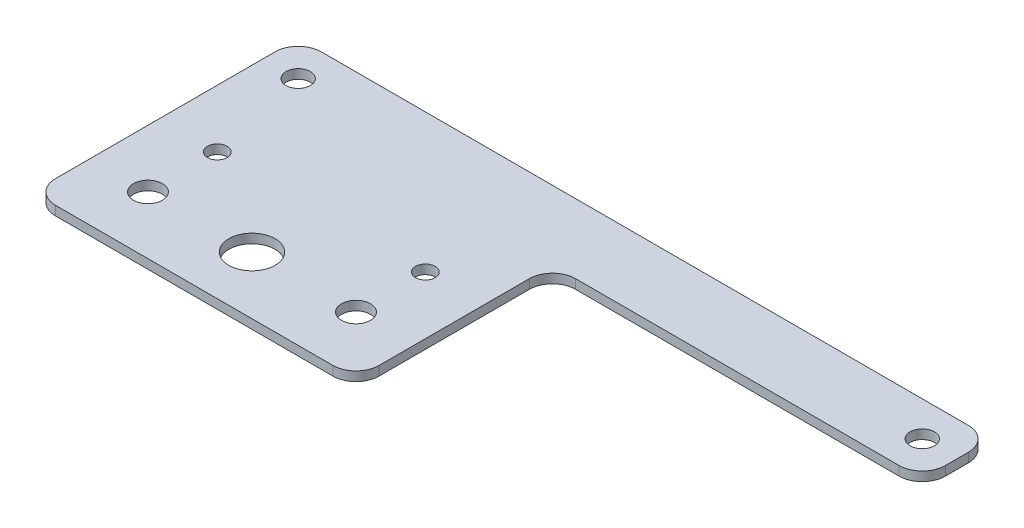
from build123d import *

# Parameters (mm, degrees)
SKETCH1_R          = 5.25
SKETCH1_R_2        = 10
SKETCH1_R_3        = 6.25
SKETCH1_R_4        = 4.25
BASE_FLANGE1_DEPTH = 4
FILLET1_R          = 10


# Sheet-metal steps are written as plain solids
with BuildPart() as part:
    # Sketch1 → Base-Flange1 (new body)
    with BuildSketch(Plane(origin=(0, 0, 0), x_dir=(1, 0, 0), z_dir=(0, 1, 0))):
        Polygon((70, -42.5), (-70, -42.5), (-70, 42.5), (-70, 72.5), (230, 72.5), (230, 42.5), (70, 42.5), align=None)
        with Locations(Location((-55, 57.5, 0), (0, 0, 270))):
            Circle(SKETCH1_R, mode=Mode.SUBTRACT)
        with Locations(Location((215, 57.5, 0), (0, 0, 270))):
            Circle(SKETCH1_R, mode=Mode.SUBTRACT)
        with Locations(Location((0, -17.5, 0), (0, 0, 270))):
            Circle(SKETCH1_R_2, mode=Mode.SUBTRACT)
        with Locations(Location((-45, -17.5, 0), (0, 0, 270))):
            Circle(SKETCH1_R_3, mode=Mode.SUBTRACT)
        with Locations(Location((45, -17.5, 0), (0, 0, 270))):
            Circle(SKETCH1_R_3, mode=Mode.SUBTRACT)
        with Locations(Location((-45, 12.5, 0), (0, 0, 270))):
            Circle(SKETCH1_R_4, mode=Mode.SUBTRACT)
        with Locations(Location((45, 12.5, 0), (0, 0, 270))):
            Circle(SKETCH1_R_4, mode=Mode.SUBTRACT)
    extrude(amount=-BASE_FLANGE1_DEPTH)

    # Fillet1
    fillet1_edges = [part.edges().sort_by_distance(p)[0] for p in [
        (-70, -2, -72.5),
        (230, -2, -72.5),
        (230, -2, -42.5),
        (70, -2, -42.5),
        (70, -2, 42.5),
        (-70, -2, 42.5),
    ]]
    fillet(fillet1_edges, radius=FILLET1_R)


solid = part.part
